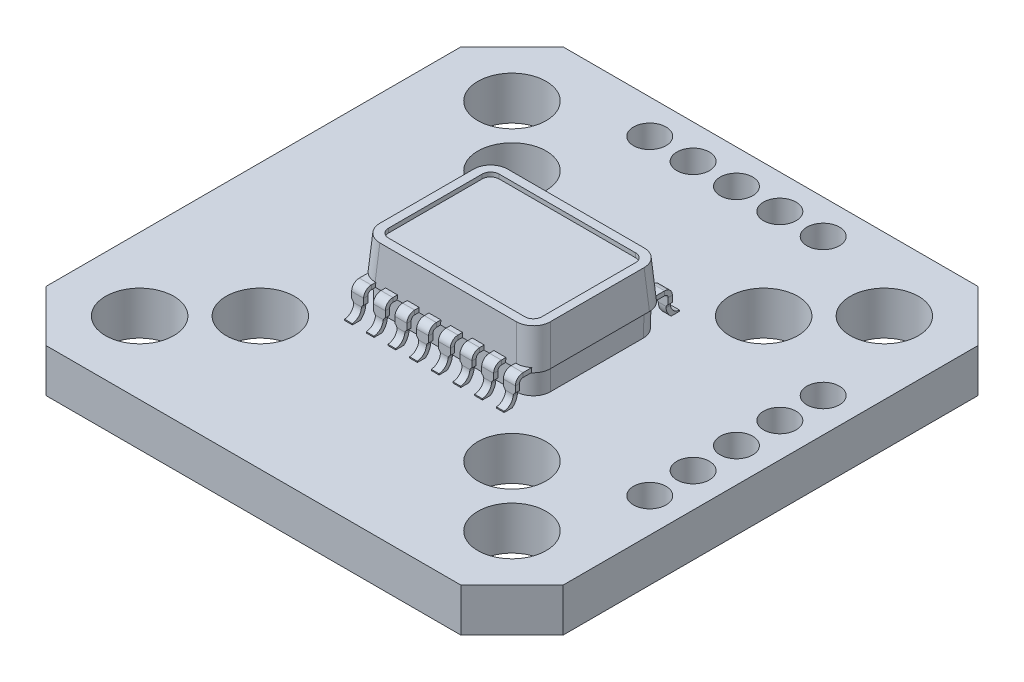
from build123d import *

# Parameters (mm, degrees)
SKETCH1_W           = 10.3
SKETCH1_H           = 7.8
BOSS_EXTRUDE1_DEPTH = 2.23
BOSS_EXTRUDE1_TAPER = 4
SKETCH4_W           = 9.988126418
SKETCH4_H           = 7.488126418
BOSS_EXTRUDE2_DEPTH = 1.35
BOSS_EXTRUDE2_TAPER = 1
FILLET1_R           = 1
FILLET2_R           = 0.15
BASE_FLANGE2_DEPTH  = 0.7
CUT_EXTRUDE2_REACH  = 12.638
LPATTERN1_COUNT     = 8
LPATTERN1_PITCH     = 1.27
CUT_EXTRUDE3_DEPTH  = 0.25
SKETCH50_W          = 30.3
SKETCH50_H          = 30.3
SKETCH50_R          = 2
SKETCH50_R_2        = 0.9525
BOSS_EXTRUDE4_DEPTH = 2.54
CHAMFER1_SIZE       = 3


# Sheet-metal steps are written as plain solids
with BuildPart() as part:
    # Sketch1 → Boss-Extrude1 (new body)
    with BuildSketch(Plane(origin=(0, 0, 0), x_dir=(1, 0, 0), z_dir=(0, 1, 0))):
        Rectangle(SKETCH1_W, SKETCH1_H)
    extrude(amount=BOSS_EXTRUDE1_DEPTH, taper=BOSS_EXTRUDE1_TAPER)

    # Sketch4 → Boss-Extrude2 (add)
    with BuildSketch(Plane.XZ):
        Rectangle(SKETCH4_W, SKETCH4_H)
    extrude(amount=BOSS_EXTRUDE2_DEPTH, taper=BOSS_EXTRUDE2_TAPER)

    # Fillet1
    fillet1_edges = [part.edges().sort_by_distance(p)[0] for p in [
        (4.982281041, -0.675, -3.732281041),
        (4.982281041, -0.675, 3.732281041),
        (-4.982281041, -0.675, 3.732281041),
        (-4.982281041, -0.675, -3.732281041),
        (5.072031605, 1.115, 3.822031605),
        (-5.072031605, 1.115, 3.822031605),
        (-5.072031605, 1.115, -3.822031605),
        (5.072031605, 1.115, -3.822031605),
    ]]
    fillet(fillet1_edges, radius=FILLET1_R)

    # Fillet2
    fillet2_edges = [part.edges().sort_by_distance(p)[0] for p in [
        (0, 0, -3.744063209),
        (-4.994063209, 0, 0),
        (4.994063209, 0, 0),
        (0, 0, 3.744063209),
        (-4.70123307, 0, -3.451233071),
        (4.70123307, 0, -3.451233071),
        (4.701233071, 0, 3.45123307),
        (-4.70123307, 0, 3.451233071),
    ]]
    fillet(fillet2_edges, radius=FILLET2_R)

    # Sketch49 → Cut-Extrude3 (cut)
    with BuildSketch(Plane(origin=(0, 2.23, 0), x_dir=(1, 0, 0), z_dir=(0, 1, 0))):
        with BuildLine():
            Line((3.996499159, 3.244063209), (-3.996499159, 3.244063209))
            add(Edge.make_bspline(
                [(-3.996499159, 3.244063209), (-4.127955984, 3.244063209), (-4.256648265, 3.190528952), (-4.440330659, 3.006987506), (-4.494063209, 2.877960638), (-4.494063209, 2.746499159)],
                knots=[0, 0, 0, 0, 0.5, 0.5, 1, 1, 1, 1], degree=3))
            Line((-4.494063209, 2.746499159), (-4.494063209, -2.746499159))
            add(Edge.make_bspline(
                [(-4.494063209, -2.746499159), (-4.494063209, -2.877955984), (-4.440528952, -3.006648265), (-4.256987506, -3.190330659), (-4.127960638, -3.244063209), (-3.996499159, -3.244063209)],
                knots=[0, 0, 0, 0, 0.5, 0.5, 1, 1, 1, 1], degree=3))
            Line((-3.996499159, -3.244063209), (3.996499159, -3.244063209))
            add(Edge.make_bspline(
                [(3.996499159, -3.244063209), (4.127955984, -3.244063209), (4.256648265, -3.190528952), (4.440330659, -3.006987506), (4.494063209, -2.877960638), (4.494063209, -2.746499159)],
                knots=[0, 0, 0, 0, 0.5, 0.5, 1, 1, 1, 1], degree=3))
            Line((4.494063209, -2.746499159), (4.494063209, 2.746499159))
            add(Edge.make_bspline(
                [(4.494063209, 2.746499159), (4.494063209, 2.877955984), (4.440528952, 3.006648265), (4.256987506, 3.190330659), (4.127960638, 3.244063209), (3.996499159, 3.244063209)],
                knots=[0, 0, 0, 0, 0.5, 0.5, 1, 1, 1, 1], degree=3))
        make_face()
    extrude(amount=-CUT_EXTRUDE3_DEPTH, mode=Mode.SUBTRACT)



with BuildPart() as body_2:
    # Sketch6 → Base-Flange2 (new body)
    with BuildSketch(Plane(origin=(4.795, 0.041838958, 0), x_dir=(0, 0, 1), z_dir=(-1, 0, 0))):
        with BuildLine():
            Line((0, -0.041838958), (-4.15, -0.041838958))
            ThreePointArc((-4.15, -0.041838958), (-4.291421356, -0.100417602), (-4.35, -0.241838958))
            Line((-4.35, -0.241838958), (-4.35, -0.746115051))
            ThreePointArc((-4.35, -0.746115051), (-4.572369352, -1.310632538), (-5.12, -1.571838958))
            Line((-5.12, -1.571838958), (-5.137439118, -1.322447945))
            ThreePointArc((-5.137439118, -1.322447945), (-4.755207777, -1.140132948), (-4.6, -0.746115051))
            Line((-4.6, -0.746115051), (-4.6, -0.241838958))
            ThreePointArc((-4.6, -0.241838958), (-4.468198052, 0.076359094), (-4.15, 0.208161042))
            Line((-4.15, 0.208161042), (0, 0.208161042))
            Line((0, 0.208161042), (0, -0.041838958))
        make_face()
    extrude(amount=BASE_FLANGE2_DEPTH)

    # Cut-Extrude2: up to this face of the body (flat: up to its plane)
    cut_extrude2_end = Plane(body_2.part.faces().sort_by_distance((4.445, -0.452138047, -4.35))[0])
    # Sketch18 → Cut-Extrude2 (cut, up to the picked face)
    with BuildSketch(Plane.XY.offset(-5.137439118), mode=Mode.PRIVATE) as cut_extrude2_sk1:
        with BuildLine():
            Line((4.095, -1.53), (4.22, -1.53))
            Line((4.22, -1.53), (4.22, -0.78))
            ThreePointArc((4.22, -0.78), (4.186506351, -0.655), (4.095, -0.563493649))
            Line((4.095, -0.563493649), (4.095, -0.704276093))
            Line((4.095, -0.704276093), (4.095, -1.280608987))
            Line((4.095, -1.280608987), (4.095, -1.53))
        make_face()
    cut_extrude2_tool1 = split(extrude(cut_extrude2_sk1.sketch, amount=CUT_EXTRUDE2_REACH, mode=Mode.PRIVATE), bisect_by=cut_extrude2_end, keep=Keep.BOTH, mode=Mode.PRIVATE)
    # Sketch18 → Cut-Extrude2 (cut, up to the picked face)
    with BuildSketch(Plane.XY.offset(-5.137439118), mode=Mode.PRIVATE) as cut_extrude2_sk2:
        with BuildLine():
            Line((4.67, -0.78), (4.67, -1.53))
            Line((4.67, -1.53), (4.795, -1.53))
            Line((4.795, -1.53), (4.795, -1.280608987))
            Line((4.795, -1.280608987), (4.795, -0.704276093))
            Line((4.795, -0.704276093), (4.795, -0.563493649))
            ThreePointArc((4.795, -0.563493649), (4.703493649, -0.655), (4.67, -0.78))
        make_face()
    cut_extrude2_tool2 = split(extrude(cut_extrude2_sk2.sketch, amount=CUT_EXTRUDE2_REACH, mode=Mode.PRIVATE), bisect_by=cut_extrude2_end, keep=Keep.BOTH, mode=Mode.PRIVATE)
    add(cut_extrude2_tool1.solids().sort_by(Axis((4.155589, -1.076863, -5.137439), (0, 0, 1)))[0], mode=Mode.SUBTRACT)
    add(cut_extrude2_tool2.solids().sort_by(Axis((4.734411, -1.076863, -5.137439), (0, 0, 1)))[0], mode=Mode.SUBTRACT)


with BuildPart() as lpattern1_1:
    # LPattern1: pattern copy
    add(body_2.part.moved(Location(Vector(-1, 0, 0) * (1 * LPATTERN1_PITCH))))


with BuildPart() as lpattern1_2:
    # LPattern1: pattern copy
    add(body_2.part.moved(Location(Vector(-1, 0, 0) * (2 * LPATTERN1_PITCH))))


with BuildPart() as lpattern1_3:
    # LPattern1: pattern copy
    add(body_2.part.moved(Location(Vector(-1, 0, 0) * (3 * LPATTERN1_PITCH))))


with BuildPart() as lpattern1_4:
    # LPattern1: pattern copy
    add(body_2.part.moved(Location(Vector(-1, 0, 0) * (4 * LPATTERN1_PITCH))))


with BuildPart() as lpattern1_5:
    # LPattern1: pattern copy
    add(body_2.part.moved(Location(Vector(-1, 0, 0) * (5 * LPATTERN1_PITCH))))


with BuildPart() as lpattern1_6:
    # LPattern1: pattern copy
    add(body_2.part.moved(Location(Vector(-1, 0, 0) * (6 * LPATTERN1_PITCH))))


with BuildPart() as lpattern1_7:
    # LPattern1: pattern copy
    add(body_2.part.moved(Location(Vector(-1, 0, 0) * (7 * LPATTERN1_PITCH))))


with BuildPart() as body_10:
    # Mirror1: mirrored copy
    add(body_2.part.mirror(Plane.XY))


with BuildPart() as body_11:
    # Mirror1 2: mirrored copy
    add(lpattern1_1.part.mirror(Plane.XY))


with BuildPart() as body_12:
    # Mirror1 3: mirrored copy
    add(lpattern1_2.part.mirror(Plane.XY))


with BuildPart() as body_13:
    # Mirror1 4: mirrored copy
    add(lpattern1_3.part.mirror(Plane.XY))


with BuildPart() as body_14:
    # Mirror1 5: mirrored copy
    add(lpattern1_4.part.mirror(Plane.XY))


with BuildPart() as body_15:
    # Mirror1 6: mirrored copy
    add(lpattern1_5.part.mirror(Plane.XY))


with BuildPart() as body_16:
    # Mirror1 7: mirrored copy
    add(lpattern1_6.part.mirror(Plane.XY))


with BuildPart() as body_17:
    # Mirror1 8: mirrored copy
    add(lpattern1_7.part.mirror(Plane.XY))


with BuildPart() as part_1:
    add(part.part)

    add(body_2.part)  # Boss-Extrude4 merges body 2

    add(lpattern1_1.part)  # Boss-Extrude4 merges LPattern1_1

    add(lpattern1_2.part)  # Boss-Extrude4 merges LPattern1_2

    add(lpattern1_3.part)  # Boss-Extrude4 merges LPattern1_3

    add(lpattern1_4.part)  # Boss-Extrude4 merges LPattern1_4

    add(lpattern1_5.part)  # Boss-Extrude4 merges LPattern1_5

    add(lpattern1_6.part)  # Boss-Extrude4 merges LPattern1_6

    add(lpattern1_7.part)  # Boss-Extrude4 merges LPattern1_7

    add(body_10.part)  # Boss-Extrude4 merges body 10

    add(body_11.part)  # Boss-Extrude4 merges body 11

    add(body_12.part)  # Boss-Extrude4 merges body 12

    add(body_13.part)  # Boss-Extrude4 merges body 13

    add(body_14.part)  # Boss-Extrude4 merges body 14

    add(body_15.part)  # Boss-Extrude4 merges body 15

    add(body_16.part)  # Boss-Extrude4 merges body 16

    add(body_17.part)  # Boss-Extrude4 merges body 17
    # Sketch50 → Boss-Extrude4 (add)
    # profile 1 of 2: a face of its own
    with BuildSketch(Plane.XZ.offset(1.35)):
        Rectangle(SKETCH50_W, SKETCH50_H)
        with Locations(Location((10.907359313, 10.907359313, 0), (0, 0, 270))):
            Circle(SKETCH50_R, mode=Mode.SUBTRACT)
        with Locations(Location((7.371825407, 7.371825407, 0), (0, 0, 270))):
            Circle(SKETCH50_R, mode=Mode.SUBTRACT)
        with Locations(Location((-10.907359313, 10.907359313, 0), (0, 0, 270))):
            Circle(SKETCH50_R, mode=Mode.SUBTRACT)
        with Locations(Location((-7.371825407, 7.371825407, 0), (0, 0, 270))):
            Circle(SKETCH50_R, mode=Mode.SUBTRACT)
        with Locations(Location((-10.907359313, -10.907359313, 0), (0, 0, 270))):
            Circle(SKETCH50_R, mode=Mode.SUBTRACT)
        with Locations(Location((-7.371825407, -7.371825407, 0), (0, 0, 270))):
            Circle(SKETCH50_R, mode=Mode.SUBTRACT)
        with Locations(Location((7.371825407, -7.371825407, 0), (0, 0, 270))):
            Circle(SKETCH50_R, mode=Mode.SUBTRACT)
        with Locations(Location((10.907359313, -10.907359313, 0), (0, 0, 270))):
            Circle(SKETCH50_R, mode=Mode.SUBTRACT)
        with Locations(Location((5.08, -13.15, 0), (0, 0, 270))):
            Circle(SKETCH50_R_2, mode=Mode.SUBTRACT)
        with Locations(Location((2.54, -13.15, 0), (0, 0, 270))):
            Circle(SKETCH50_R_2, mode=Mode.SUBTRACT)
        with Locations(Location((0, -13.15, 0), (0, 0, 270))):
            Circle(SKETCH50_R_2, mode=Mode.SUBTRACT)
        with Locations(Location((-2.54, -13.15, 0), (0, 0, 270))):
            Circle(SKETCH50_R_2, mode=Mode.SUBTRACT)
        with Locations(Location((-5.08, -13.15, 0), (0, 0, 270))):
            Circle(SKETCH50_R_2, mode=Mode.SUBTRACT)
        with Locations(Location((13.15, -5.08, 0), (0, 0, 270))):
            Circle(SKETCH50_R_2, mode=Mode.SUBTRACT)
        with Locations(Location((13.15, -2.54, 0), (0, 0, 270))):
            Circle(SKETCH50_R_2, mode=Mode.SUBTRACT)
        with Locations(Location((13.15, 5.08, 0), (0, 0, 270))):
            Circle(SKETCH50_R_2, mode=Mode.SUBTRACT)
        with Locations(Location((13.15, 2.54, 0), (0, 0, 270))):
            Circle(SKETCH50_R_2, mode=Mode.SUBTRACT)
        with Locations(Location((13.15, 0, 0), (0, 0, 270))):
            Circle(SKETCH50_R_2, mode=Mode.SUBTRACT)
        with BuildLine():
            Line((-4.970498872, 2.720651177), (-4.970498872, -2.720651177))
            add(Edge.make_bspline(
                [(-4.970498872, -2.720651177), (-4.970498872, -3.720498872), (-3.970651177, -3.720498872)],
                knots=[5.497939437, 5.497939437, 5.497939437, 7.068431177, 7.068431177, 7.068431177], degree=2, weights=[1, 0.707214461, 1]))
            Line((-3.970651177, -3.720498872), (3.970651177, -3.720498872))
            add(Edge.make_bspline(
                [(3.970651177, -3.720498872), (4.970498872, -3.720498872), (4.970498872, -2.720651177)],
                knots=[5.497939437, 5.497939437, 5.497939437, 7.068431177, 7.068431177, 7.068431177], degree=2, weights=[1, 0.707214461, 1]))
            Line((4.970498872, -2.720651177), (4.970498872, 2.720651177))
            add(Edge.make_bspline(
                [(4.970498872, 2.720651177), (4.970498872, 3.720498872), (3.970651177, 3.720498872)],
                knots=[5.497939437, 5.497939437, 5.497939437, 7.068431177, 7.068431177, 7.068431177], degree=2, weights=[1, 0.707214461, 1]))
            Line((3.970651177, 3.720498872), (-3.970651177, 3.720498872))
            add(Edge.make_bspline(
                [(-3.970651177, 3.720498872), (-4.970498872, 3.720498872), (-4.970498872, 2.720651177)],
                knots=[5.497939437, 5.497939437, 5.497939437, 7.068431177, 7.068431177, 7.068431177], degree=2, weights=[1, 0.707214461, 1]))
        make_face(mode=Mode.SUBTRACT)
    # profile 2 of 2: a face of its own
    with BuildSketch(Plane.XZ.offset(1.35)):
        with BuildLine():
            add(Edge.make_bspline(
                [(-3.970651177, 3.720498872), (-4.970498872, 3.720498872), (-4.970498872, 2.720651177)],
                knots=[5.497939437, 5.497939437, 5.497939437, 7.068431177, 7.068431177, 7.068431177], degree=2, weights=[1, 0.707214461, 1]))
            Line((-4.970498872, 2.720651177), (-4.970498872, -2.720651177))
            add(Edge.make_bspline(
                [(-4.970498872, -2.720651177), (-4.970498872, -3.720498872), (-3.970651177, -3.720498872)],
                knots=[5.497939437, 5.497939437, 5.497939437, 7.068431177, 7.068431177, 7.068431177], degree=2, weights=[1, 0.707214461, 1]))
            Line((-3.970651177, -3.720498872), (3.970651177, -3.720498872))
            add(Edge.make_bspline(
                [(3.970651177, -3.720498872), (4.970498872, -3.720498872), (4.970498872, -2.720651177)],
                knots=[5.497939437, 5.497939437, 5.497939437, 7.068431177, 7.068431177, 7.068431177], degree=2, weights=[1, 0.707214461, 1]))
            Line((4.970498872, -2.720651177), (4.970498872, 2.720651177))
            add(Edge.make_bspline(
                [(4.970498872, 2.720651177), (4.970498872, 3.720498872), (3.970651177, 3.720498872)],
                knots=[5.497939437, 5.497939437, 5.497939437, 7.068431177, 7.068431177, 7.068431177], degree=2, weights=[1, 0.707214461, 1]))
            Line((3.970651177, 3.720498872), (-3.970651177, 3.720498872))
        make_face()
    extrude(amount=BOSS_EXTRUDE4_DEPTH)

    # Chamfer1
    chamfer1_edges = [part_1.edges().sort_by_distance(p)[0] for p in [
        (-15.15, -2.62, -15.15),
        (15.15, -2.62, -15.15),
        (15.15, -2.62, 15.15),
        (-15.15, -2.62, 15.15),
    ]]
    chamfer(chamfer1_edges, length=CHAMFER1_SIZE)


solid = part_1.part
